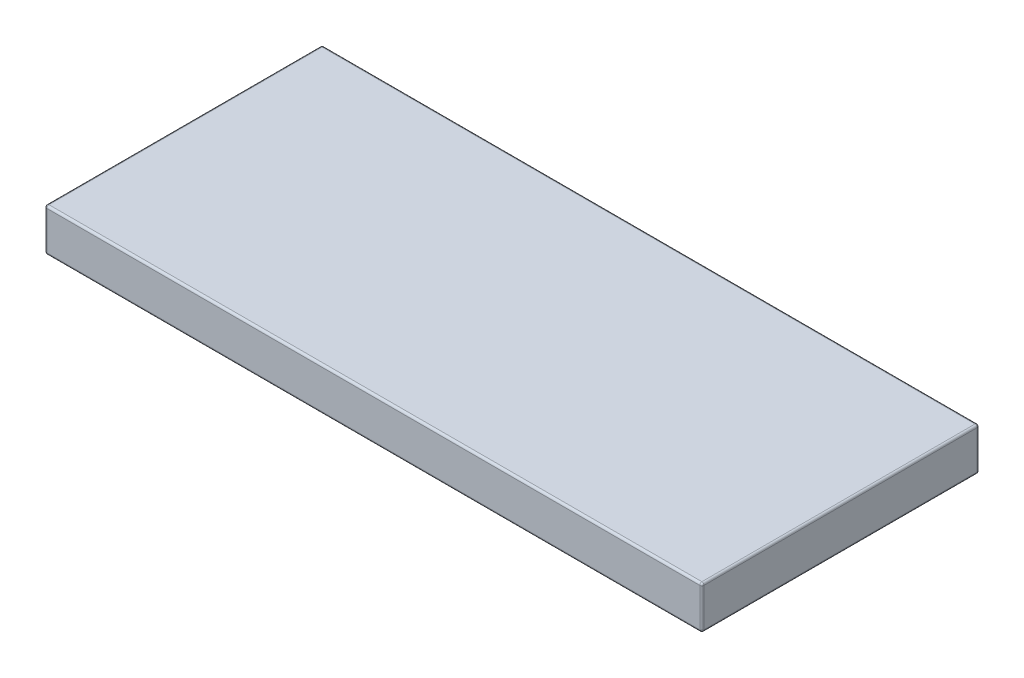
from build123d import *

# Parameters (mm, degrees)
SKETCH1_W  = 154
SKETCH1_H  = 65
BASE_DEPTH = 10
FILLET1_R  = 0.5


with BuildPart() as part:
    # Sketch1 → base (new body)
    with BuildSketch(Plane(origin=(0, 0, 0), x_dir=(1, 0, 0), z_dir=(0, 1, 0))):
        Rectangle(SKETCH1_W, SKETCH1_H)
    extrude(amount=BASE_DEPTH)

    # Fillet1
    fillet1_edges = [part.edges().sort_by_distance(p)[0] for p in [
        (77, 5, -32.5),
        (-77, 5, -32.5),
        (-77, 5, 32.5),
        (77, 5, 32.5),
        (0, 10, -32.5),
        (-77, 10, 0),
        (0, 10, 32.5),
        (77, 10, 0),
        (0, 0, -32.5),
        (-77, 0, 0),
        (0, 0, 32.5),
        (77, 0, 0),
    ]]
    fillet(fillet1_edges, radius=FILLET1_R)


solid = part.part
